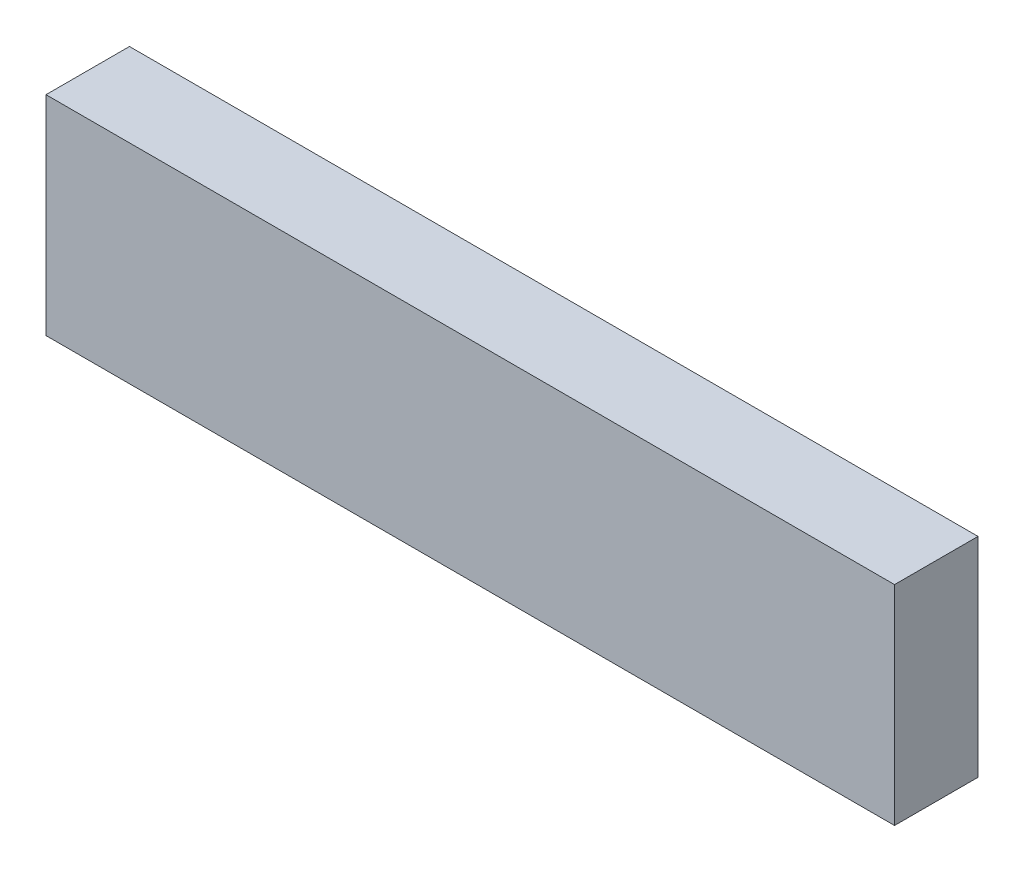
from build123d import *

# Parameters (mm, degrees)
SKETCH1_W           = 12
SKETCH1_H           = 30
BOSS_EXTRUDE1_DEPTH = 61


with BuildPart() as part:
    # Sketch1 → Boss-Extrude1 (new, symmetric)
    with BuildSketch(Plane(origin=(0, 0, 0), x_dir=(0, 0, -1), z_dir=(1, 0, 0))):
        Rectangle(SKETCH1_W, SKETCH1_H)
    extrude(amount=BOSS_EXTRUDE1_DEPTH, both=True)


solid = part.part
